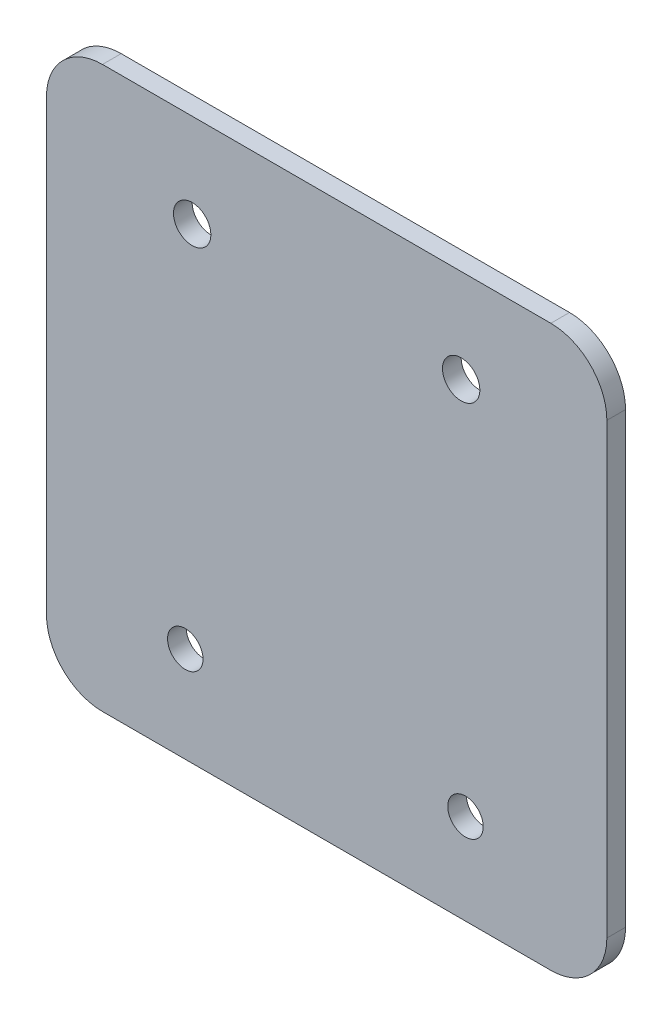
from build123d import *

# Parameters (mm, degrees)
SKETCH1_W           = 76.2
SKETCH1_H           = 76.2
SKETCH1_R           = 2.54
BOSS_EXTRUDE1_DEPTH = 2.54
FILLET1_R           = 7.62
FILLET2_R           = 7.62
FILLET3_R           = 7.62
FILLET4_R           = 7.62
CAVITY1_OUTLINE_R   = 2.413
CAVITY1_DEPTH       = 2.54


# Read off the part's stored shape, not the designer's step: Cavity1
with BuildPart() as part:
    # Sketch1 → Boss-Extrude1 (new body)
    with BuildSketch(Plane.XY):
        Rectangle(SKETCH1_W, SKETCH1_H)
        with Locations((-18.288, 25.4)):
            Circle(SKETCH1_R, mode=Mode.SUBTRACT)
        with Locations((18.288, 25.4)):
            Circle(SKETCH1_R, mode=Mode.SUBTRACT)
    extrude(amount=BOSS_EXTRUDE1_DEPTH)

    # Fillet1
    fillet1_edges = [part.edges().sort_by_distance(p)[0] for p in [
        (38.1, 38.1, 1.27),
    ]]
    fillet(fillet1_edges, radius=FILLET1_R)

    # Fillet2
    fillet2_edges = [part.edges().sort_by_distance(p)[0] for p in [
        (38.1, -38.1, 1.27),
    ]]
    fillet(fillet2_edges, radius=FILLET2_R)

    # Fillet3
    fillet3_edges = [part.edges().sort_by_distance(p)[0] for p in [
        (-38.1, -38.1, 1.27),
    ]]
    fillet(fillet3_edges, radius=FILLET3_R)

    # Fillet4
    fillet4_edges = [part.edges().sort_by_distance(p)[0] for p in [
        (-38.1, 38.1, 1.27),
    ]]
    fillet(fillet4_edges, radius=FILLET4_R)

    # Cavity1 outline → Cavity1 (cut)
    with BuildSketch(Plane.XY):
        with Locations((18.877459074, -25.789271924)):
            Circle(CAVITY1_OUTLINE_R)
        with Locations((-19.220954695, -25.105760078)):
            Circle(CAVITY1_OUTLINE_R)
    extrude(amount=CAVITY1_DEPTH, mode=Mode.SUBTRACT)


solid = part.part
